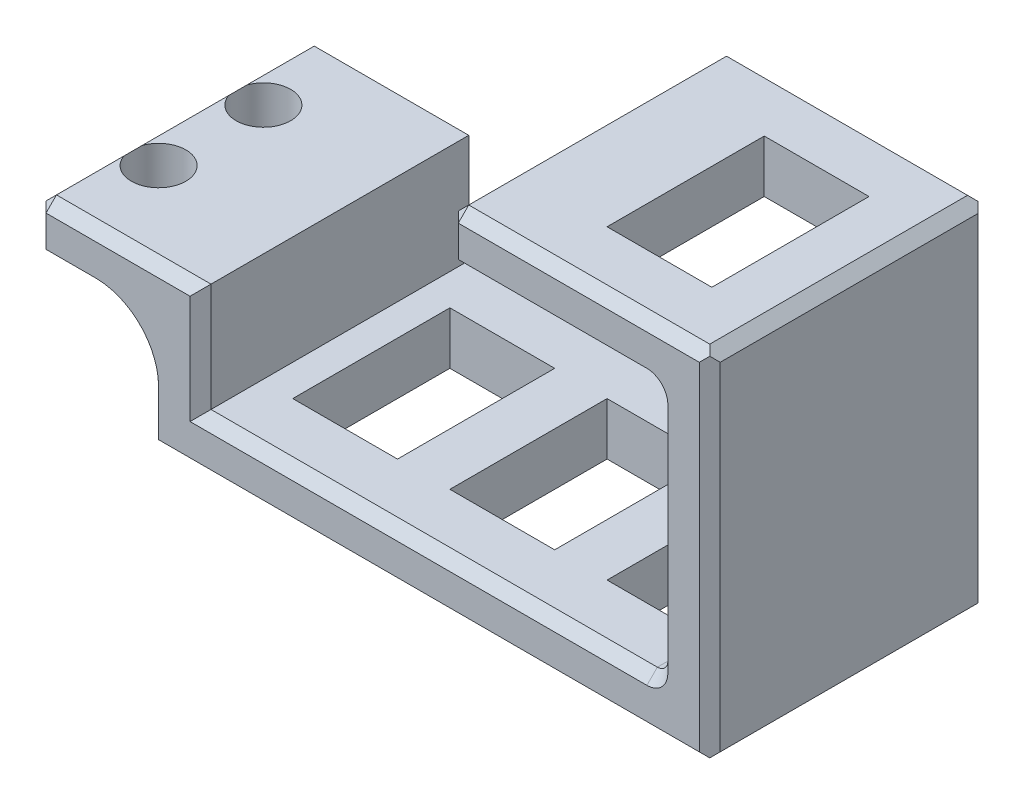
from build123d import *

# Parameters (mm, degrees)
SALIENTE_EXTRUIR1_DEPTH = 26.6
CROQUIS2_R              = 2.6
CORTAR_EXTRUIR1_DEPTH   = 92.175808743
REDONDEO1_R             = 5
REDONDEO2_R             = 1
CORTAR_EXTRUIR2_REACH   = 97.539
CROQUIS3_W              = 10
CROQUIS3_H              = 15
CROQUIS4_W              = 10
CROQUIS4_H              = 15
CORTAR_EXTRUIR3_DEPTH   = 96.539115054
CHAFL_N2_SIZE           = 1


with BuildPart() as part:
    # Croquis1 → Saliente-Extruir1 (new body)
    with BuildSketch(Plane.XY):
        Polygon((36.55, -8), (20.802876039, -8), (20.802876039, -13), (31.55, -13), (31.55, -23.36), (36.55, -23.36), (85.15, -23.36), (85.15, -18.36), (85.15, 10.84), (80.15, 10.84), (60.15, 10.84), (60.15, 5.84), (80.15, 5.84), (80.15, -18.36), (36.55, -18.36), align=None)
    extrude(amount=-SALIENTE_EXTRUIR1_DEPTH)

    # Croquis2 → Cortar-Extruir1 (cut, through all)
    with BuildSketch(Plane(origin=(0, -8, 0), x_dir=(1, 0, 0), z_dir=(0, 1, 0))):
        with Locations(Location((24.250000128, 18.3, 0), (0, 0, 270))):
            Circle(CROQUIS2_R)
        with Locations(Location((24.250000128, 8.3, 0), (0, 0, 270))):
            Circle(CROQUIS2_R)
    extrude(amount=-CORTAR_EXTRUIR1_DEPTH, mode=Mode.SUBTRACT)

    # Redondeo1
    redondeo1_edges = [part.edges().sort_by_distance(p)[0] for p in [
        (31.55, -13, -13.3),
    ]]
    fillet(redondeo1_edges, radius=REDONDEO1_R)

    # Redondeo2
    redondeo2_edges = [part.edges().sort_by_distance(p)[0] for p in [
        (80.15, 5.84, -13.3),
        (80.15, -18.36, -13.3),
    ]]
    fillet(redondeo2_edges, radius=REDONDEO2_R)

    # Chaflán1
    # the kernel refuses this chamfer: 1 mm, written as the material it takes off along each edge
    with BuildSketch(Plane(origin=(21.469542706, -12.333333333, -0.666666667), x_dir=(2.5121479338940403e-15, -0.7071067811865476, -0.7071067811865475), z_dir=(-0.5773502691896265, -0.5773502691896264, 0.5773502691896244)), Plane(origin=(60.816666667, 10.173333333, -0.666666667), x_dir=(-0.7071067811865475, -1.25607396694702e-15, -0.7071067811865475), z_dir=(-0.5773502691896268, 0.5773502691896247, 0.5773502691896258)), Plane(origin=(60.816666667, 6.506666667, -0.666666667), x_dir=(0, -0.7071067811865471, -0.7071067811865478), z_dir=(-0.577350269189626, -0.577350269189626, 0.5773502691896254)), Plane(origin=(60.816666667, 6.506666667, -25.933333333), x_dir=(0, 0.7071067811865471, -0.7071067811865478), z_dir=(-0.577350269189626, -0.577350269189626, -0.5773502691896254)), Plane(origin=(21.469542706, -8.666666667, -25.933333333), x_dir=(2.51214793389404e-15, 0.7071067811865475, 0.7071067811865475), z_dir=(-0.5773502691896265, 0.5773502691896265, -0.5773502691896244))) as chafl_n1_piece_1:
        Polygon((-0.707106781, 0.40824829), (0.707106781, 0.40824829), (0, -0.816496581), align=None)
    extrude(amount=1.270170592, mode=Mode.SUBTRACT)
    with BuildSketch(Plane(origin=(21.469542706, -8.666666667, -0.666666667), x_dir=(2.5121479338940403e-15, 0.7071067811865476, -0.7071067811865475), z_dir=(-0.5773502691896265, 0.5773502691896264, 0.5773502691896244)), Plane(origin=(60.816666667, 10.173333333, -25.933333333), x_dir=(-0.7071067811865475, -1.25607396694702e-15, 0.7071067811865475), z_dir=(-0.5773502691896268, 0.5773502691896247, -0.5773502691896258)), Plane(origin=(21.469542706, -12.333333333, -25.933333333), x_dir=(2.51214793389404e-15, -0.7071067811865475, 0.7071067811865475), z_dir=(-0.5773502691896265, -0.5773502691896265, -0.5773502691896244))) as chafl_n1_piece_2:
        Polygon((-0.707106781, -0.40824829), (0.707106781, -0.40824829), (0, 0.816496581), align=None)
    extrude(amount=1.270170592, mode=Mode.SUBTRACT)
    with BuildSketch(Plane(origin=(85.15, 13.411682988, 0), x_dir=(-0.9996219169112968, 0, 0.027495876610586483), z_dir=(0, -1, 0))) as chafl_n1_piece_3:
        with BuildLine():
            Line((1.028673195, 0), (-0.056547155, 1.027117794))
            Line((-0.056547155, 1.027117794), (-0.076539593, 1.026567876))
            ThreePointArc((-0.076539593, 1.026567876), (-0.034129227, 0.51339783), (-0.019992438, -0.000549918))
            Line((-0.019992438, -0.000549918), (0.000549918, -0.019992438))
            ThreePointArc((0.000549918, -0.019992438), (0.514497665, -0.00585565), (1.029223113, -0.019992438))
            Line((1.029223113, -0.019992438), (1.028673195, 0))
        make_face()
    extrude(amount=39.343365976, mode=Mode.SUBTRACT)
    with BuildSketch(Plane(origin=(87.721682988, -23.36, 0), x_dir=(0, 0.9996219169112968, 0.02749587661058639), z_dir=(-1, 0, 0))) as chafl_n1_piece_4:
        with BuildLine():
            Line((1.028673195, 0), (-0.056547155, 1.027117794))
            Line((-0.056547155, 1.027117794), (-0.076539593, 1.026567876))
            ThreePointArc((-0.076539593, 1.026567876), (-0.034129227, 0.51339783), (-0.019992438, -0.000549918))
            Line((-0.019992438, -0.000549918), (0.000549918, -0.019992438))
            ThreePointArc((0.000549918, -0.019992438), (0.514497665, -0.00585565), (1.029223113, -0.019992438))
            Line((1.029223113, -0.019992438), (1.028673195, 0))
        make_face()
    extrude(amount=58.743365976, mode=Mode.SUBTRACT)
    with BuildSketch(Plane(origin=(18.231193051, -13, 0), x_dir=(0, 0.9996219169112968, 0.02749587661058639), z_dir=(1, 0, 0)), Plane(origin=(18.231193051, -13, -26.6), x_dir=(0, -0.027495876610585647, 0.9996219169112968), z_dir=(1, 0, 0))) as chafl_n1_piece_5:
        with BuildLine():
            Line((1.028673195, 0), (-0.056547155, -1.027117794))
            Line((-0.056547155, -1.027117794), (-0.076539593, -1.026567876))
            ThreePointArc((-0.076539593, -1.026567876), (-0.034129227, -0.51339783), (-0.019992438, 0.000549918))
            Line((-0.019992438, 0.000549918), (0.000549918, 0.019992438))
            ThreePointArc((0.000549918, 0.019992438), (0.514497665, 0.00585565), (1.029223113, 0.019992438))
            Line((1.029223113, 0.019992438), (1.028673195, 0))
        make_face()
    extrude(amount=8.318806949, mode=Mode.SUBTRACT)
    with BuildSketch(Plane(origin=(20.802876039, -5.428317012, 0), x_dir=(0.9996219169112968, 0, 0.02749587661058644), z_dir=(0, -1, 0)), Plane(origin=(60.15, 13.411682988, 0), x_dir=(0.9996219169112968, 0, 0.027495876610586292), z_dir=(0, -1, 0)), Plane(origin=(20.802876039, -5.428317012, -26.6), x_dir=(-0.027495876610585647, 0, 0.9996219169112968), z_dir=(0, -1, 0)), Plane(origin=(60.15, 13.411682988, -26.6), x_dir=(-0.0274958766105891, 0, 0.9996219169112968), z_dir=(0, -1, 0))) as chafl_n1_piece_6:
        with BuildLine():
            Line((1.028673195, 0), (-0.056547155, -1.027117794))
            Line((-0.056547155, -1.027117794), (-0.076539593, -1.026567876))
            ThreePointArc((-0.076539593, -1.026567876), (-0.034129227, -0.51339783), (-0.019992438, 0.000549918))
            Line((-0.019992438, 0.000549918), (0.000549918, 0.019992438))
            ThreePointArc((0.000549918, 0.019992438), (0.514497665, 0.00585565), (1.029223113, 0.019992438))
            Line((1.029223113, 0.019992438), (1.028673195, 0))
        make_face()
    extrude(amount=10.143365976, mode=Mode.SUBTRACT)
    with BuildSketch(Plane(origin=(39.121682988, -8, 0), x_dir=(0, -0.9996219169112968, 0.02749587661058639), z_dir=(-1, 0, 0)), Plane(origin=(39.121682988, -8, -26.6), x_dir=(0, 0.02749587661058651, 0.9996219169112968), z_dir=(-1, 0, 0))) as chafl_n1_piece_7:
        with BuildLine():
            Line((1.028673195, 0), (-0.056547155, -1.027117794))
            Line((-0.056547155, -1.027117794), (-0.076539593, -1.026567876))
            ThreePointArc((-0.076539593, -1.026567876), (-0.034129227, -0.51339783), (-0.019992438, 0.000549918))
            Line((-0.019992438, 0.000549918), (0.000549918, 0.019992438))
            ThreePointArc((0.000549918, 0.019992438), (0.514497665, 0.00585565), (1.029223113, 0.019992438))
            Line((1.029223113, 0.019992438), (1.028673195, 0))
        make_face()
    extrude(amount=20.890489937, mode=Mode.SUBTRACT)
    with BuildSketch(Plane(origin=(36.55, -18.36, 0), x_dir=(-0.9996219169112968, 0, 0.027495876610586292), z_dir=(0, 1, 0)), Plane(origin=(36.55, -18.36, -26.6), x_dir=(0.0274958766105891, 0, 0.9996219169112968), z_dir=(0, 1, 0))) as chafl_n1_piece_8:
        with BuildLine():
            Line((1.028673195, 0), (-0.056547155, -1.027117794))
            Line((-0.056547155, -1.027117794), (-0.076539593, -1.026567876))
            ThreePointArc((-0.076539593, -1.026567876), (-0.034129227, -0.51339783), (-0.019992438, 0.000549918))
            Line((-0.019992438, 0.000549918), (0.000549918, 0.019992438))
            ThreePointArc((0.000549918, 0.019992438), (0.514497665, 0.00585565), (1.029223113, 0.019992438))
            Line((1.029223113, 0.019992438), (1.028673195, 0))
        make_face()
    extrude(amount=12.931682988, mode=Mode.SUBTRACT)
    with BuildSketch(Plane(origin=(79.15, -18.36, 0), x_dir=(0, -0.9996219169112968, 0.02749587661058639), z_dir=(-1, 0, 0)), Plane(origin=(79.15, -18.36, -26.6), x_dir=(0, 0.027495876610585647, 0.9996219169112968), z_dir=(-1, 0, 0))) as chafl_n1_piece_9:
        with BuildLine():
            Line((1.028673195, 0), (-0.056547155, -1.027117794))
            Line((-0.056547155, -1.027117794), (-0.076539593, -1.026567876))
            ThreePointArc((-0.076539593, -1.026567876), (-0.034129227, -0.51339783), (-0.019992438, 0.000549918))
            Line((-0.019992438, 0.000549918), (0.000549918, 0.019992438))
            ThreePointArc((0.000549918, 0.019992438), (0.514497665, 0.00585565), (1.029223113, 0.019992438))
            Line((1.029223113, 0.019992438), (1.028673195, 0))
        make_face()
    extrude(amount=42.6, mode=Mode.SUBTRACT)
    with BuildSketch(Plane(origin=(57.578317012, 10.84, 0), x_dir=(0, -0.9996219169112968, 0.02749587661058637), z_dir=(1, 0, 0))) as chafl_n1_piece_10:
        with BuildLine():
            Line((1.028673195, 0), (-0.056547155, 1.027117794))
            Line((-0.056547155, 1.027117794), (-0.076539593, 1.026567876))
            ThreePointArc((-0.076539593, 1.026567876), (-0.034129227, 0.51339783), (-0.019992438, -0.000549918))
            Line((-0.019992438, -0.000549918), (0.000549918, -0.019992438))
            ThreePointArc((0.000549918, -0.019992438), (0.514497665, -0.00585565), (1.029223113, -0.019992438))
            Line((1.029223113, -0.019992438), (1.028673195, 0))
        make_face()
    extrude(amount=30.143365976, mode=Mode.SUBTRACT)
    with BuildSketch(Plane(origin=(60.15, 10.84, 2.571682988), x_dir=(-0.0274958766105891, -0.9996219169112968, 0), z_dir=(0, 0, -1)), Plane(origin=(60.15, 5.84, 2.571682988), x_dir=(0.9996219169112968, -0.027495876610586414, 0), z_dir=(0, 0, -1))) as chafl_n1_piece_11:
        with BuildLine():
            Line((1.028673195, 0), (-0.056547155, -1.027117794))
            Line((-0.056547155, -1.027117794), (-0.076539593, -1.026567876))
            ThreePointArc((-0.076539593, -1.026567876), (-0.034129227, -0.51339783), (-0.019992438, 0.000549918))
            Line((-0.019992438, 0.000549918), (0.000549918, 0.019992438))
            ThreePointArc((0.000549918, 0.019992438), (0.514497665, 0.00585565), (1.029223113, 0.019992438))
            Line((1.029223113, 0.019992438), (1.028673195, 0))
        make_face()
    extrude(amount=31.743365976, mode=Mode.SUBTRACT)
    with BuildSketch(Plane(origin=(57.578317012, 5.84, -26.6), x_dir=(0, -0.02749587661058651, 0.9996219169112968), z_dir=(1, 0, 0)), Plane(origin=(57.578317012, 5.84, 0), x_dir=(0, 0.9996219169112968, 0.02749587661058638), z_dir=(1, 0, 0))) as chafl_n1_piece_12:
        with BuildLine():
            Line((1.028673195, 0), (-0.056547155, -1.027117794))
            Line((-0.056547155, -1.027117794), (-0.076539593, -1.026567876))
            ThreePointArc((-0.076539593, -1.026567876), (-0.034129227, -0.51339783), (-0.019992438, 0.000549918))
            Line((-0.019992438, 0.000549918), (0.000549918, 0.019992438))
            ThreePointArc((0.000549918, 0.019992438), (0.514497665, 0.00585565), (1.029223113, 0.019992438))
            Line((1.029223113, 0.019992438), (1.028673195, 0))
        make_face()
    extrude(amount=21.571682988, mode=Mode.SUBTRACT)
    with BuildSketch(Plane(origin=(20.802876039, -8, 2.571682988), x_dir=(0.9996219169112968, 0.02749587661058651, 0), z_dir=(0, 0, -1)), Plane(origin=(20.802876039, -13, 2.571682988), x_dir=(-0.027495876610585647, 0.9996219169112968, 0), z_dir=(0, 0, -1))) as chafl_n1_piece_13:
        with BuildLine():
            Line((1.028673195, 0), (-0.056547155, 1.027117794))
            Line((-0.056547155, 1.027117794), (-0.076539593, 1.026567876))
            ThreePointArc((-0.076539593, 1.026567876), (-0.034129227, 0.51339783), (-0.019992438, -0.000549918))
            Line((-0.019992438, -0.000549918), (0.000549918, -0.019992438))
            ThreePointArc((0.000549918, -0.019992438), (0.514497665, -0.00585565), (1.029223113, -0.019992438))
            Line((1.029223113, -0.019992438), (1.028673195, 0))
        make_face()
    extrude(amount=31.743365976, mode=Mode.SUBTRACT)
    with BuildSketch(Plane(origin=(31.55, -18, -26.6), x_dir=(-0.027495876610585647, 0, 0.9996219169112968), z_dir=(0, -1, 0)), Plane(origin=(31.55, -18, 0), x_dir=(0.9996219169112968, 0, 0.02749587661058644), z_dir=(0, -1, 0))) as chafl_n1_piece_14:
        with BuildLine():
            Line((1.028673195, 0), (-0.056547155, -1.027117794))
            Line((-0.056547155, -1.027117794), (-0.076539593, -1.026567876))
            ThreePointArc((-0.076539593, -1.026567876), (-0.034129227, -0.51339783), (-0.019992438, 0.000549918))
            Line((-0.019992438, 0.000549918), (0.000549918, 0.019992438))
            ThreePointArc((0.000549918, 0.019992438), (0.514497665, 0.00585565), (1.029223113, 0.019992438))
            Line((1.029223113, 0.019992438), (1.028673195, 0))
        make_face()
    extrude(amount=7.931682988, mode=Mode.SUBTRACT)
    with BuildSketch(Plane(origin=(28.978317012, -23.36, -26.6), x_dir=(0, -0.027495876610585647, 0.9996219169112968), z_dir=(1, 0, 0))) as chafl_n1_piece_15:
        with BuildLine():
            Line((1.028673195, 0), (-0.056547155, -1.027117794))
            Line((-0.056547155, -1.027117794), (-0.076539593, -1.026567876))
            ThreePointArc((-0.076539593, -1.026567876), (-0.034129227, -0.51339783), (-0.019992438, 0.000549918))
            Line((-0.019992438, 0.000549918), (0.000549918, 0.019992438))
            ThreePointArc((0.000549918, 0.019992438), (0.514497665, 0.00585565), (1.029223113, 0.019992438))
            Line((1.029223113, 0.019992438), (1.028673195, 0))
        make_face()
    extrude(amount=58.743365976, mode=Mode.SUBTRACT)
    with BuildSketch(Plane(origin=(85.15, -25.931682988, -26.6), x_dir=(0.0274958766105822, 0, 0.999621916911297), z_dir=(0, 1, 0))) as chafl_n1_piece_16:
        with BuildLine():
            Line((1.028673195, 0), (-0.056547155, -1.027117794))
            Line((-0.056547155, -1.027117794), (-0.076539593, -1.026567876))
            ThreePointArc((-0.076539593, -1.026567876), (-0.034129227, -0.51339783), (-0.019992438, 0.000549918))
            Line((-0.019992438, 0.000549918), (0.000549918, 0.019992438))
            ThreePointArc((0.000549918, 0.019992438), (0.514497665, 0.00585565), (1.029223113, 0.019992438))
            Line((1.029223113, 0.019992438), (1.028673195, 0))
        make_face()
    extrude(amount=39.343365976, mode=Mode.SUBTRACT)
    with BuildSketch(Plane(origin=(87.721682988, 10.84, -26.6), x_dir=(0, 0.027495876610585647, 0.9996219169112968), z_dir=(-1, 0, 0))) as chafl_n1_piece_17:
        with BuildLine():
            Line((1.028673195, 0), (-0.056547155, -1.027117794))
            Line((-0.056547155, -1.027117794), (-0.076539593, -1.026567876))
            ThreePointArc((-0.076539593, -1.026567876), (-0.034129227, -0.51339783), (-0.019992438, 0.000549918))
            Line((-0.019992438, 0.000549918), (0.000549918, 0.019992438))
            ThreePointArc((0.000549918, 0.019992438), (0.514497665, 0.00585565), (1.029223113, 0.019992438))
            Line((1.029223113, 0.019992438), (1.028673195, 0))
        make_face()
    extrude(amount=30.143365976, mode=Mode.SUBTRACT)
    with BuildSketch(Plane(origin=(26.55, -18, 0), x_dir=(0, 1, 0), z_dir=(-1, 0, 0))) as chafl_n1_piece_18:
        with BuildLine():
            Line((6.028284271, -0.028284271), (4.971715729, 1.028284271))
            Line((4.971715729, 1.028284271), (4.951715729, 1.028284271))
            ThreePointArc((4.951715729, 1.028284271), (4.98, 0.514142136), (4.98, 0))
            Line((4.98, 0), (5, -0.02))
            ThreePointArc((5, -0.02), (5.514142136, -0.02), (6.028284271, -0.048284271))
            Line((6.028284271, -0.048284271), (6.028284271, -0.028284271))
        make_face()
    revolve(axis=Axis((26.55, -18, 0), (0, 0, -1)), revolution_arc=90, mode=Mode.SUBTRACT)
    with BuildSketch(Plane(origin=(26.55, -18, -26.6), x_dir=(0, 1, 0), z_dir=(-1, 0, 0))) as chafl_n1_piece_19:
        with BuildLine():
            Line((6.028284271, 0.028284271), (4.971715729, -1.028284271))
            Line((4.971715729, -1.028284271), (4.951715729, -1.028284271))
            ThreePointArc((4.951715729, -1.028284271), (4.98, -0.514142136), (4.98, 0))
            Line((4.98, 0), (5, 0.02))
            ThreePointArc((5, 0.02), (5.514142136, 0.02), (6.028284271, 0.048284271))
            Line((6.028284271, 0.048284271), (6.028284271, 0.028284271))
        make_face()
    revolve(axis=Axis((26.55, -18, -26.6), (0, 0, -1)), revolution_arc=90, mode=Mode.SUBTRACT)
    with BuildSketch(Plane(origin=(80.15, 4.84, -26.6), x_dir=(-0.0274958766105822, 0, 0.999621916911297), z_dir=(0, -1, 0)), Plane(origin=(80.15, 4.84, 0), x_dir=(0.9996219169112968, 0, 0.027495876610586483), z_dir=(0, -1, 0))) as chafl_n1_piece_20:
        with BuildLine():
            Line((1.028673195, 0), (-0.056547155, -1.027117794))
            Line((-0.056547155, -1.027117794), (-0.076539593, -1.026567876))
            ThreePointArc((-0.076539593, -1.026567876), (-0.034129227, -0.51339783), (-0.019992438, 0.000549918))
            Line((-0.019992438, 0.000549918), (0.000549918, 0.019992438))
            ThreePointArc((0.000549918, 0.019992438), (0.514497665, 0.00585565), (1.029223113, 0.019992438))
            Line((1.029223113, 0.019992438), (1.028673195, 0))
        make_face()
    extrude(amount=22.2, mode=Mode.SUBTRACT)
    with BuildSketch(Plane(origin=(79.15, -17.36, 0), x_dir=(0, -1, 0), z_dir=(-1, 0, 0))) as chafl_n1_piece_21:
        with BuildLine():
            Line((2.028284271, 0.028284271), (0.971715729, -1.028284271))
            Line((0.971715729, -1.028284271), (0.951715729, -1.028284271))
            ThreePointArc((0.951715729, -1.028284271), (0.98, -0.514142136), (0.98, 0))
            Line((0.98, 0), (1, 0.02))
            ThreePointArc((1, 0.02), (1.514142136, 0.02), (2.028284271, 0.048284271))
            Line((2.028284271, 0.048284271), (2.028284271, 0.028284271))
        make_face()
    revolve(axis=Axis((79.15, -17.36, 0), (0, 0, 1)), revolution_arc=90, mode=Mode.SUBTRACT)
    with BuildSketch(Plane(origin=(79.15, -17.36, -26.6), x_dir=(0, -1, 0), z_dir=(-1, 0, 0))) as chafl_n1_piece_22:
        with BuildLine():
            Line((0.971715729, 1.028284271), (2.028284271, -0.028284271))
            Line((2.028284271, -0.028284271), (2.028284271, -0.048284271))
            ThreePointArc((2.028284271, -0.048284271), (1.514142136, -0.02), (1, -0.02))
            Line((1, -0.02), (0.98, 0))
            ThreePointArc((0.98, 0), (0.98, 0.514142136), (0.951715729, 1.028284271))
            Line((0.951715729, 1.028284271), (0.971715729, 1.028284271))
        make_face()
    revolve(axis=Axis((79.15, -17.36, -26.6), (0, 0, 1)), revolution_arc=90, mode=Mode.SUBTRACT)
    with BuildSketch(Plane(origin=(79.15, 4.84, 0), x_dir=(1, 0, 0), z_dir=(0, -1, 0))) as chafl_n1_piece_23:
        with BuildLine():
            Line((2.028284271, 0.028284271), (0.971715729, -1.028284271))
            Line((0.971715729, -1.028284271), (0.951715729, -1.028284271))
            ThreePointArc((0.951715729, -1.028284271), (0.98, -0.514142136), (0.98, 0))
            Line((0.98, 0), (1, 0.02))
            ThreePointArc((1, 0.02), (1.514142136, 0.02), (2.028284271, 0.048284271))
            Line((2.028284271, 0.048284271), (2.028284271, 0.028284271))
        make_face()
    revolve(axis=Axis((79.15, 4.84, 0), (0, 0, 1)), revolution_arc=90, mode=Mode.SUBTRACT)
    with BuildSketch(Plane(origin=(79.15, 4.84, -26.6), x_dir=(1, 0, 0), z_dir=(0, -1, 0))) as chafl_n1_piece_24:
        with BuildLine():
            Line((0.971715729, 1.028284271), (2.028284271, -0.028284271))
            Line((2.028284271, -0.028284271), (2.028284271, -0.048284271))
            ThreePointArc((2.028284271, -0.048284271), (1.514142136, -0.02), (1, -0.02))
            Line((1, -0.02), (0.98, 0))
            ThreePointArc((0.98, 0), (0.98, 0.514142136), (0.951715729, 1.028284271))
            Line((0.951715729, 1.028284271), (0.971715729, 1.028284271))
        make_face()
    revolve(axis=Axis((79.15, 4.84, -26.6), (0, 0, 1)), revolution_arc=90, mode=Mode.SUBTRACT)
    with BuildSketch(Plane(origin=(79.15, -18.36, 0), x_dir=(0, -0.9996219169112968, 0.02749587661058639), z_dir=(-1, 0, 0))) as chafl_n1_piece_25a_section:
        with BuildLine():
            Line((1.028673195, 0), (-0.056547155, -1.027117794))
            Line((-0.056547155, -1.027117794), (-0.076539593, -1.026567876))
            ThreePointArc((-0.076539593, -1.026567876), (-0.034129227, -0.51339783), (-0.019992438, 0.000549918))
            Line((-0.019992438, 0.000549918), (0.000549918, 0.019992438))
            ThreePointArc((0.000549918, 0.019992438), (0.514497665, 0.00585565), (1.029223113, 0.019992438))
            Line((1.029223113, 0.019992438), (1.028673195, 0))
        make_face()
    chafl_n1_piece_25a = extrude(amount=45.171682988, mode=Mode.PRIVATE)
    chafl_n1_piece_25a = split(chafl_n1_piece_25a, bisect_by=Plane(origin=(36.55, -18.689793627, -0.329793627), z_dir=(-1, 0, 0)), keep=Keep.TOP, mode=Mode.PRIVATE)
    with BuildSketch(Plane(origin=(36.55, -20.931682988, 0), x_dir=(-0.9996219169112968, 0, 0.027495876610586292), z_dir=(0, 1, 0))) as chafl_n1_piece_25b_section:
        with BuildLine():
            Line((1.028673195, 0), (-0.056547155, -1.027117794))
            Line((-0.056547155, -1.027117794), (-0.076539593, -1.026567876))
            ThreePointArc((-0.076539593, -1.026567876), (-0.034129227, -0.51339783), (-0.019992438, 0.000549918))
            Line((-0.019992438, 0.000549918), (0.000549918, 0.019992438))
            ThreePointArc((0.000549918, 0.019992438), (0.514497665, 0.00585565), (1.029223113, 0.019992438))
            Line((1.029223113, 0.019992438), (1.028673195, 0))
        make_face()
    chafl_n1_piece_25b = extrude(amount=15.503365976, mode=Mode.PRIVATE)
    chafl_n1_piece_25b = split(chafl_n1_piece_25b, bisect_by=Plane(origin=(36.220206373, -18.36, -0.329793627), z_dir=(0, -1, 0)), keep=Keep.TOP, mode=Mode.PRIVATE)
    chafl_n1_piece_25 = chafl_n1_piece_25a & chafl_n1_piece_25b
    add(chafl_n1_piece_25, mode=Mode.SUBTRACT)
    with BuildSketch(Plane(origin=(79.15, -18.36, -26.6), x_dir=(0, 0.027495876610585647, 0.9996219169112968), z_dir=(-1, 0, 0))) as chafl_n1_piece_26a_section:
        with BuildLine():
            Line((1.028673195, 0), (-0.056547155, -1.027117794))
            Line((-0.056547155, -1.027117794), (-0.076539593, -1.026567876))
            ThreePointArc((-0.076539593, -1.026567876), (-0.034129227, -0.51339783), (-0.019992438, 0.000549918))
            Line((-0.019992438, 0.000549918), (0.000549918, 0.019992438))
            ThreePointArc((0.000549918, 0.019992438), (0.514497665, 0.00585565), (1.029223113, 0.019992438))
            Line((1.029223113, 0.019992438), (1.028673195, 0))
        make_face()
    chafl_n1_piece_26a = extrude(amount=45.171682988, mode=Mode.PRIVATE)
    chafl_n1_piece_26a = split(chafl_n1_piece_26a, bisect_by=Plane(origin=(36.55, -18.689793627, -26.270206373), z_dir=(-1, 0, 0)), keep=Keep.TOP, mode=Mode.PRIVATE)
    with BuildSketch(Plane(origin=(36.55, -20.931682988, -26.6), x_dir=(0.0274958766105891, 0, 0.9996219169112968), z_dir=(0, 1, 0))) as chafl_n1_piece_26b_section:
        with BuildLine():
            Line((1.028673195, 0), (-0.056547155, -1.027117794))
            Line((-0.056547155, -1.027117794), (-0.076539593, -1.026567876))
            ThreePointArc((-0.076539593, -1.026567876), (-0.034129227, -0.51339783), (-0.019992438, 0.000549918))
            Line((-0.019992438, 0.000549918), (0.000549918, 0.019992438))
            ThreePointArc((0.000549918, 0.019992438), (0.514497665, 0.00585565), (1.029223113, 0.019992438))
            Line((1.029223113, 0.019992438), (1.028673195, 0))
        make_face()
    chafl_n1_piece_26b = extrude(amount=15.503365976, mode=Mode.PRIVATE)
    chafl_n1_piece_26b = split(chafl_n1_piece_26b, bisect_by=Plane(origin=(36.220206373, -18.36, -26.270206373), z_dir=(0, -1, 0)), keep=Keep.TOP, mode=Mode.PRIVATE)
    chafl_n1_piece_26 = chafl_n1_piece_26a & chafl_n1_piece_26b
    add(chafl_n1_piece_26, mode=Mode.SUBTRACT)

    # Croquis3 → Cortar-Extruir2 (cut, up to next)
    with BuildSketch(Plane.XZ.offset(23.36), mode=Mode.PRIVATE) as cortar_extruir2_sk1:
        with Locations((59.55, -13.3)):
            Rectangle(CROQUIS3_W, CROQUIS3_H)
    cortar_extruir2_tool1 = extrude(cortar_extruir2_sk1.sketch, amount=-CORTAR_EXTRUIR2_REACH, mode=Mode.PRIVATE) & part.part
    # Croquis3 → Cortar-Extruir2 (cut, up to next)
    with BuildSketch(Plane.XZ.offset(23.36), mode=Mode.PRIVATE) as cortar_extruir2_sk2:
        with Locations((44.55, -13.3)):
            Rectangle(CROQUIS3_W, CROQUIS3_H)
    cortar_extruir2_tool2 = extrude(cortar_extruir2_sk2.sketch, amount=-CORTAR_EXTRUIR2_REACH, mode=Mode.PRIVATE) & part.part
    # Croquis3 → Cortar-Extruir2 (cut, up to next)
    with BuildSketch(Plane.XZ.offset(23.36), mode=Mode.PRIVATE) as cortar_extruir2_sk3:
        with Locations((74.55, -13.3)):
            Rectangle(CROQUIS3_W, CROQUIS3_H)
    cortar_extruir2_tool3 = extrude(cortar_extruir2_sk3.sketch, amount=-CORTAR_EXTRUIR2_REACH, mode=Mode.PRIVATE) & part.part
    add(cortar_extruir2_tool1.solids().sort_by_distance((59.55, -23.36, -13.3))[0], mode=Mode.SUBTRACT)
    add(cortar_extruir2_tool2.solids().sort_by_distance((44.55, -23.36, -13.3))[0], mode=Mode.SUBTRACT)
    add(cortar_extruir2_tool3.solids().sort_by_distance((74.55, -23.36, -13.3))[0], mode=Mode.SUBTRACT)

    # Croquis4 → Cortar-Extruir3 (cut, through all)
    with BuildSketch(Plane.XZ.offset(23.36)):
        with Locations((74.55, -13.3)):
            Rectangle(CROQUIS4_W, CROQUIS4_H)
    extrude(amount=-CORTAR_EXTRUIR3_DEPTH, mode=Mode.SUBTRACT)

    # Chaflán2
    chafl_n2_edges = [part.edges().sort_by_distance(p)[0] for p in [
        (85.15, 10.84, -13.3),
        (85.15, -23.36, -13.3),
    ]]
    chamfer(chafl_n2_edges, length=CHAFL_N2_SIZE)


solid = part.part
